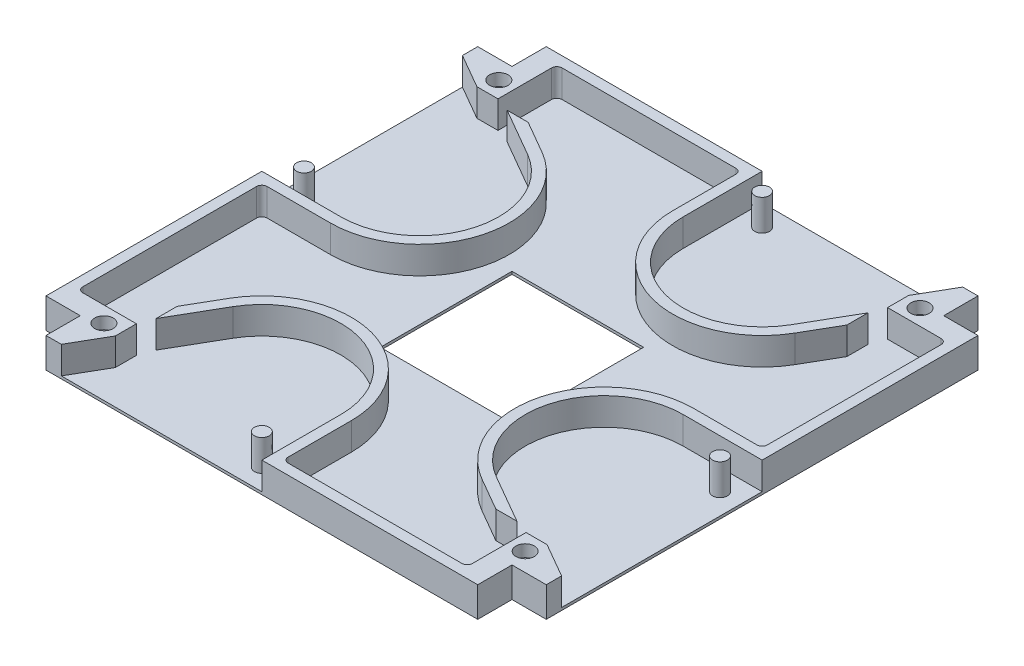
from build123d import *

# Parameters (mm, degrees)
BOSS_EXTRUDE1_DEPTH              = 0.5
BOSS_EXTRUDE2_DEPTH              = 5.2
CIRPATTERN1_COUNT                = 4
SKETCH8_R                        = 1.4
BOSS_EXTRUDE4_DEPTH              = 5.9
CIRPATTERN2_COUNT                = 4
FILLET1_R                        = 1
SKETCH11_W                       = 25
SKETCH11_H                       = 25
CUT_EXTRUDE2_DEPTH               = 126.311013881
SKETCH15_R                       = 0.9
CUT_EXTRUDE3_DEPTH               = 126.301756572
SKETCH16_R                       = 1.75
CUT_EXTRUDE4_DEPTH               = 2.3
CBORE_FOR_M1_6_SHCS2_D           = 1.8
CBORE_FOR_M1_6_SHCS2_CBORE_D     = 3.5
CBORE_FOR_M1_6_SHCS2_CBORE_DEPTH = 1.6


with BuildPart() as part:
    # Sketch1 → Boss-Extrude1 (new body)
    with BuildSketch(Plane(origin=(0, 0, 0), x_dir=(1, 0, 0), z_dir=(0, 1, 0))):
        Polygon((0, 0), (0, 6.51), (82, 6.51), (82, 0), (88.51, 0), (88.51, -82), (82, -82), (82, -88.51), (0, -88.51), (0, -82), (-6.51, -82), (-6.51, 0), align=None)
    extrude(amount=BOSS_EXTRUDE1_DEPTH)

    # Sketch2 → Boss-Extrude2 (add)
    with BuildSketch(Plane(origin=(0, 0.5, 0), x_dir=(1, 0, 0), z_dir=(0, 1, 0))):
        Polygon((82, 6.51), (79.094010768, 6.51), (75.335460515, 0), (75.335460515, -4), (86.51, -4), (86.51, -41), (88.51, -41), (88.51, 0), (82, 0), align=None)
        with BuildLine():
            Line((41, 6.51), (0, 6.51))
            Line((0, 6.51), (0, 4.51))
            Line((0, 4.51), (39, 4.51))
            Line((39, 4.51), (39, -8.49))
            ThreePointArc((39, -8.49), (51.600076233, -24.910739047), (70.722431864, -16.99))
            Line((70.722431864, -16.99), (74.335460515, -10.732050808))
            Line((74.335460515, -10.732050808), (74.335460515, -6.732050808))
            Line((74.335460515, -6.732050808), (68.990381057, -15.99))
            ThreePointArc((68.990381057, -15.99), (52.117714323, -22.978887394), (41, -8.49))
            Line((41, -8.49), (41, 6.51))
        make_face()
    boss_extrude2 = extrude(amount=BOSS_EXTRUDE2_DEPTH)

    # CirPattern1: Boss-Extrude2 ×4 about axis
    cirpattern1_axis = Axis((41, -0.325, 41), (0, 1, 0))
    for i in range(1, CIRPATTERN1_COUNT):
        add(boss_extrude2.rotate(cirpattern1_axis, i * 360 / CIRPATTERN1_COUNT))

    # Sketch8 → Boss-Extrude4 (add)
    with BuildSketch(Plane(origin=(0, 0.5, 0), x_dir=(1, 0, 0), z_dir=(0, 1, 0))):
        with Locations((37, -84.51)):
            Circle(SKETCH8_R)
    boss_extrude4 = extrude(amount=BOSS_EXTRUDE4_DEPTH)

    # CirPattern2: Boss-Extrude4 ×4 about axis
    cirpattern2_axis = Axis((41, -0.325, 41), (0, 1, 0))
    for i in range(1, CIRPATTERN2_COUNT):
        add(boss_extrude4.rotate(cirpattern2_axis, i * 360 / CIRPATTERN2_COUNT))

    # Fillet1
    fillet1_edges = [part.edges().sort_by_distance(p)[0] for p in [
        (-4.51, 3.1, 78),
        (-4.51, 3.1, 43),
        (4, 3.1, -4.51),
        (39, 3.1, -4.51),
        (86.51, 3.1, 4),
        (86.51, 3.1, 39),
        (78, 3.1, 86.51),
        (43, 3.1, 86.51),
    ]]
    fillet(fillet1_edges, radius=FILLET1_R)

    # Sketch11 → Cut-Extrude2 (cut, through all)
    with BuildSketch(Plane(origin=(0, 0.5, 0), x_dir=(1, 0, 0), z_dir=(0, 1, 0))):
        with Locations((41, -41)):
            Rectangle(SKETCH11_W, SKETCH11_H)
    extrude(amount=-CUT_EXTRUDE2_DEPTH, mode=Mode.SUBTRACT)

    # Sketch15 → Cut-Extrude3 (cut, through all)
    with BuildSketch(Plane(origin=(0, 5.7, 0), x_dir=(1, 0, 0), z_dir=(0, 1, 0))):
        with Locations((81, -78.5)):
            Circle(SKETCH15_R)
        with Locations((78.5, -1)):
            Circle(SKETCH15_R)
        with Locations((1, -3.5)):
            Circle(SKETCH15_R)
        with Locations((3.5, -81)):
            Circle(SKETCH15_R)
    extrude(amount=-CUT_EXTRUDE3_DEPTH, mode=Mode.SUBTRACT)

    # Sketch16 → Cut-Extrude4 (cut)
    with BuildSketch(Plane(origin=(0, 5.7, 0), x_dir=(1, 0, 0), z_dir=(0, 1, 0))):
        with Locations((78.5, -1)):
            Circle(SKETCH16_R)
        with Locations((81, -78.5)):
            Circle(SKETCH16_R)
        with Locations((3.5, -81)):
            Circle(SKETCH16_R)
        with Locations((1, -3.5)):
            Circle(SKETCH16_R)
    extrude(amount=-CUT_EXTRUDE4_DEPTH, mode=Mode.SUBTRACT)

    # CBORE for M1.6 SHCS2 (through all)
    with Locations(Plane(origin=(81, 0, 78.5), x_dir=(0, 0, -1), z_dir=(0, -1, 0))):
        with Locations((0, 0), (77.5, -2.5), (75, -80), (-2.5, -77.5)):
            CounterBoreHole(CBORE_FOR_M1_6_SHCS2_D / 2, CBORE_FOR_M1_6_SHCS2_CBORE_D / 2, CBORE_FOR_M1_6_SHCS2_CBORE_DEPTH)


solid = part.part
